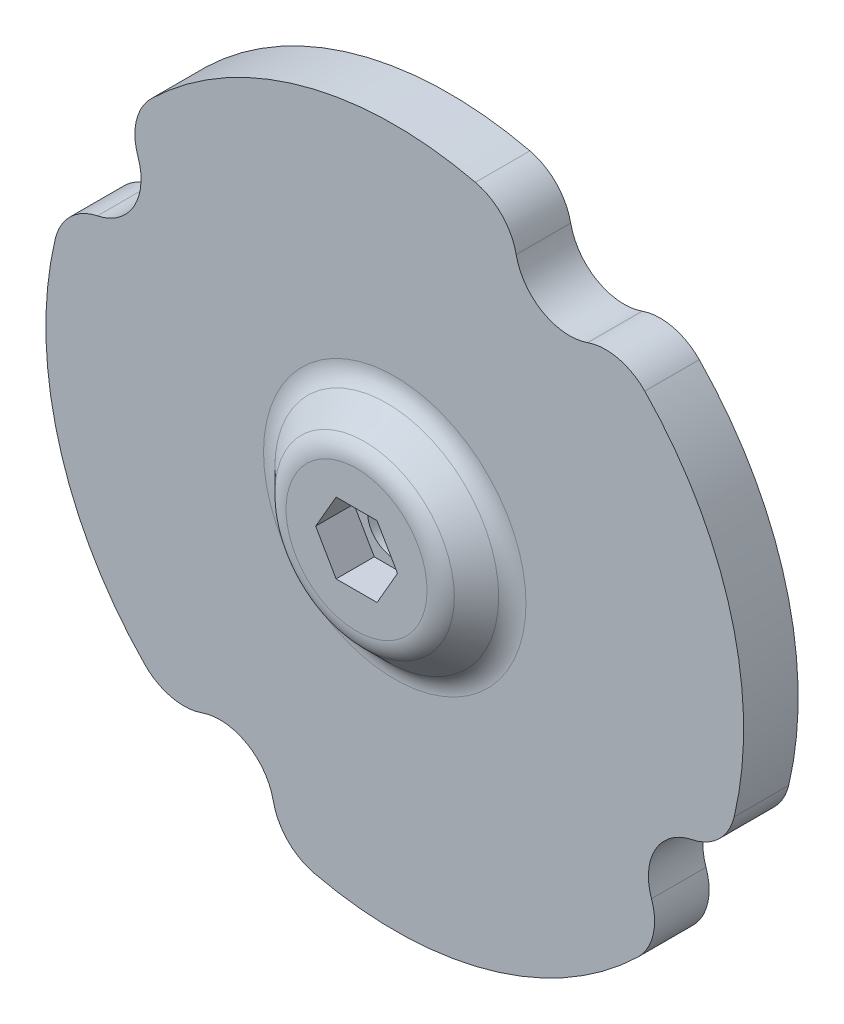
from build123d import *

# Parameters (mm, degrees)
SKETCH1_R           = 64
SKETCH1_R_2         = 5
BOSS_EXTRUDE1_DEPTH = 10
SKETCH2_R           = 15
BOSS_EXTRUDE2_DEPTH = 7
SKETCH3_R           = 10
CUT_EXTRUDE1_DEPTH  = 10
FILLET1_R           = 10
CHAMFER1_SIZE       = 7


with BuildPart() as part:
    # Sketch1 → Boss-Extrude1 (new body)
    with BuildSketch(Plane.XY):
        Circle(SKETCH1_R)
        Circle(SKETCH1_R_2, mode=Mode.SUBTRACT)
    extrude(amount=BOSS_EXTRUDE1_DEPTH)

    # Sketch2 → Boss-Extrude2 (add)
    with BuildSketch(Plane.XY.offset(10)):
        Circle(SKETCH2_R)
        Polygon((7.505553499, 0), (3.75277675, 6.5), (-3.75277675, 6.5), (-7.505553499, 0), (-3.75277675, -6.5), (3.75277675, -6.5), align=None, mode=Mode.SUBTRACT)
    extrude(amount=BOSS_EXTRUDE2_DEPTH)

    # Sketch3 → Cut-Extrude1 (cut)
    with BuildSketch(Plane(origin=(0, 0, 0), x_dir=(-1, 0, 0), z_dir=(0, 0, -1))):
        with Locations((56.533626817, 32.077235525)):
            Circle(SKETCH3_R)
        with Locations((32.077235525, -56.533626817)):
            Circle(SKETCH3_R)
        with Locations((-56.533626817, -32.077235525)):
            Circle(SKETCH3_R)
        with Locations((-32.077235525, 56.533626817)):
            Circle(SKETCH3_R)
    extrude(amount=-CUT_EXTRUDE1_DEPTH, mode=Mode.SUBTRACT)

    # Fillet1
    fillet1_edges = [part.edges().sort_by_distance(p)[0] for p in [
        (22.646447987, 59.859321693, 5),
        (39.769398937, 50.143742463, 5),
        (59.859321693, -22.646447987, 5),
        (50.143742463, -39.769398937, 5),
        (-22.646447987, -59.859321693, 5),
        (-39.769398937, -50.143742463, 5),
        (-59.859321693, 22.646447987, 5),
        (-50.143742463, 39.769398937, 5),
    ]]
    fillet(fillet1_edges, radius=FILLET1_R)

    # Chamfer1
    chamfer1_edges = [part.edges().sort_by_distance(p)[0] for p in [
        (-15, 0, 10),
    ]]
    chamfer(chamfer1_edges, length=CHAMFER1_SIZE - 0.0001)  # a hair under: the kernel refuses the full size

    # Fillet2: read off the stored shape, not the designer's step
    # Fillet2 outline → Fillet2 (revolve, cut)
    with BuildSketch(Plane.XZ):
        with BuildLine():
            ThreePointArc((12.928932188, 17), (14.84234935, 16.619397663), (16.464466094, 15.535533906))
            Line((16.464466094, 15.535533906), (16.464466094, 17))
            Line((16.464466094, 17), (12.928932188, 17))
        make_face()
    revolve(axis=Axis((0, 0, 0), (0, 0, 1)), mode=Mode.SUBTRACT)

    # Fillet2 2 outline → Fillet2 2 (revolve)
    with BuildSketch(Plane.XZ):
        with BuildLine():
            ThreePointArc((24.071067812, 10), (22.15765065, 10.380602337), (20.535533906, 11.464466094))
            Line((20.535533906, 11.464466094), (20.535533906, 10))
            Line((20.535533906, 10), (24.071067812, 10))
        make_face()
    revolve(axis=Axis((0, 0, 0), (0, 0, 1)))


solid = part.part
